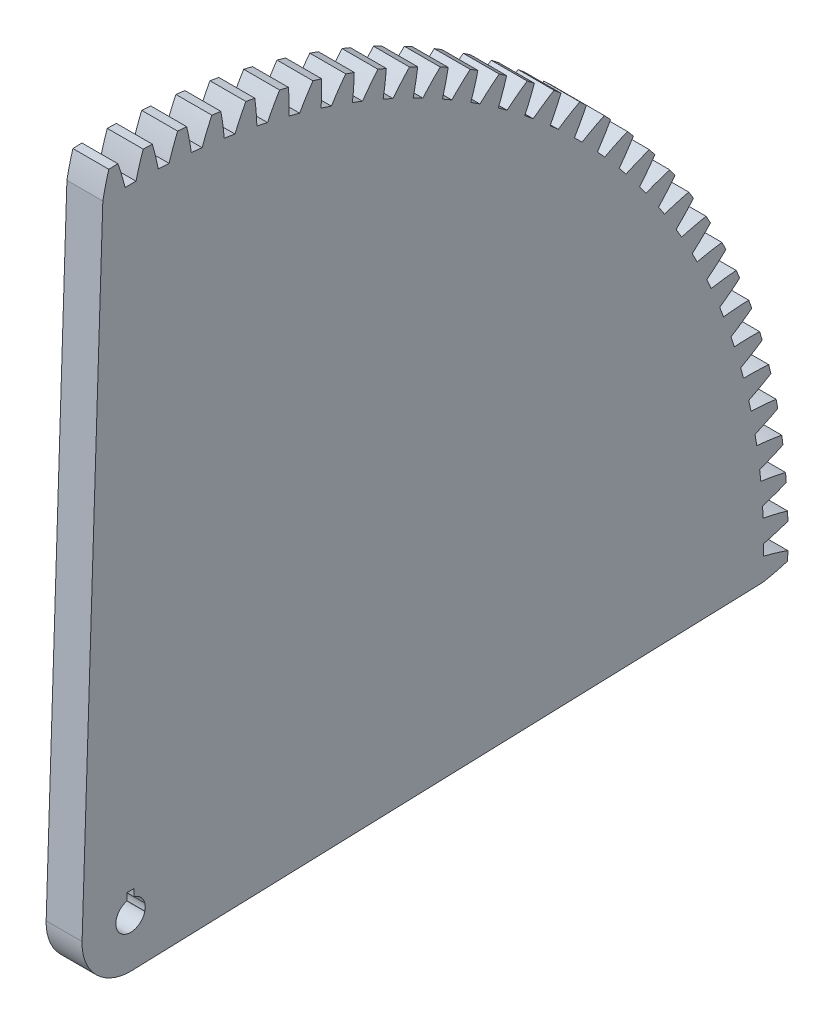
from build123d import *

# Parameters (mm, degrees)
BASPROSKE_W        = 10
BASPROSKE_H        = 183
TOOTHCUT_DEPTH     = 259.994208429
TEETHCUTS_COUNT    = 120
TEETHCUTS_ANGLE    = 357
BORSKE_R           = 3
BORE_DEPTH         = 50.0000508
KEYSKE_W           = 2
KEYSKE_H           = 4
KEYWAY_DEPTH       = 50.0000508
KEYWAY2_COUNT      = 2
KEYWAY2_ANGLE      = 90
CUT_EXTRUDE1_DEPTH = 259.946207215
CUT_EXTRUDE2_DEPTH = 259.946207215


with BuildPart() as part:
    # BasProSke → Base-Revolve (revolve)
    with BuildSketch(Plane(origin=(0, 0, 0), x_dir=(1, 0, 0), z_dir=(0, 1, 0)), mode=Mode.PRIVATE) as base_revolve_sk:
        with Locations((5, 91.5)):
            Rectangle(BASPROSKE_W, BASPROSKE_H)
    revolve(base_revolve_sk.sketch.rotate(Axis((-10, 0, 0), (1, 0, 0)), 180), axis=Axis((-10, 0, 0), (1, 0, 0)))

    # TooCutSke → ToothCut (cut, through all)
    with BuildSketch(Plane(origin=(0, 0, 0), x_dir=(0, 0, -1), z_dir=(1, 0, 0))):
        with BuildLine():
            ThreePointArc((1.51134717, 176.242519928), (0, 176.249), (-1.51134717, 176.242519928))
            ThreePointArc((-1.51134717, 176.242519928), (-2.440411129, 179.641656325), (-3.534672788, 182.991265183))
            ThreePointArc((-3.534672788, 182.991265183), (0, 183.0254), (3.534672788, 182.991265183))
            ThreePointArc((3.534672788, 182.991265183), (2.440411129, 179.641656325), (1.51134717, 176.242519928))
        make_face()
    toothcut = extrude(amount=TOOTHCUT_DEPTH, mode=Mode.SUBTRACT)

    # TeethCuts: ToothCut ×120 about axis
    teethcuts_axis = Axis((-10, 0, 0), (1, 0, 0))
    for i in range(1, TEETHCUTS_COUNT):
        add(toothcut.rotate(teethcuts_axis, i * TEETHCUTS_ANGLE / (TEETHCUTS_COUNT - 1)), mode=Mode.SUBTRACT)

    # BorSke → Bore (cut, symmetric)
    with BuildSketch(Plane(origin=(0, 0, 0), x_dir=(0, 0, -1), z_dir=(1, 0, 0))):
        with Locations(Location((0, 0, 0), (0, 0, 180))):
            Circle(BORSKE_R)
    extrude(amount=BORE_DEPTH, both=True, mode=Mode.SUBTRACT)

    # KeySke → Keyway (cut, symmetric)
    with BuildSketch(Plane(origin=(0, 0, 0), x_dir=(0, 0, -1), z_dir=(1, 0, 0))):
        with Locations((0, 2)):
            Rectangle(KEYSKE_W, KEYSKE_H)
    keyway = extrude(amount=KEYWAY_DEPTH, both=True, mode=Mode.SUBTRACT)

    # Keyway2: Keyway ×2 about axis
    keyway2_axis = Axis((0, 0, 0), (-1, 0, 0))
    for i in range(1, KEYWAY2_COUNT):
        add(keyway.rotate(keyway2_axis, i * KEYWAY2_ANGLE / (KEYWAY2_COUNT - 1)), mode=Mode.SUBTRACT)

    # Sketch1 → Cut-Extrude1 (cut, through all)
    with BuildSketch(Plane(origin=(10, 0, 0), x_dir=(0, 0, -1), z_dir=(1, 0, 0))):
        with BuildLine():
            Line((176.080083479, -7.71454489), (0.443888689, -13.492700354))
            ThreePointArc((0.443888689, -13.492700354), (-9.545941546, -9.545941546), (-13.492700354, 0.443888689))
            Line((-13.492700354, 0.443888689), (-7.71454489, 176.080083479))
            Line((-7.71454489, 176.080083479), (-14.251827406, 194.700723838))
            Line((-14.251827406, 194.700723838), (-32.749780015, 211.870036755))
            Line((-32.749780015, 211.870036755), (-115.066994713, 184.879129582))
            Line((-115.066994713, 184.879129582), (-189.395687031, 62.84812364))
            Line((-189.395687031, 62.84812364), (-203.232112927, -19.149114264))
            Line((-203.232112927, -19.149114264), (-161.479992923, -112.268128157))
            Line((-161.479992923, -112.268128157), (-102.832278001, -176.057436953))
            Line((-102.832278001, -176.057436953), (0.443888689, -208.07803376))
            Line((0.443888689, -208.07803376), (141.643568474, -161.780215449))
            Line((141.643568474, -161.780215449), (187.805581807, -54.591848009))
            Line((187.805581807, -54.591848009), (186.310919547, -8.498456478))
            Line((186.310919547, -8.498456478), (176.080083479, -7.71454489))
        make_face()
    extrude(amount=-CUT_EXTRUDE1_DEPTH, mode=Mode.SUBTRACT)

    # Sketch2 → Cut-Extrude2 (cut, through all)
    with BuildSketch(Plane(origin=(10, 0, 0), x_dir=(0, 0, -1), z_dir=(1, 0, 0))):
        with BuildLine():
            Line((-1, 3.97617907), (-1, 6))
            Line((-1, 6), (1, 6))
            Line((1, 6), (1, 3.97617907))
            ThreePointArc((1, 3.97617907), (0, -4.1), (-1, 3.97617907))
        make_face()
    extrude(amount=-CUT_EXTRUDE2_DEPTH, mode=Mode.SUBTRACT)


solid = part.part
